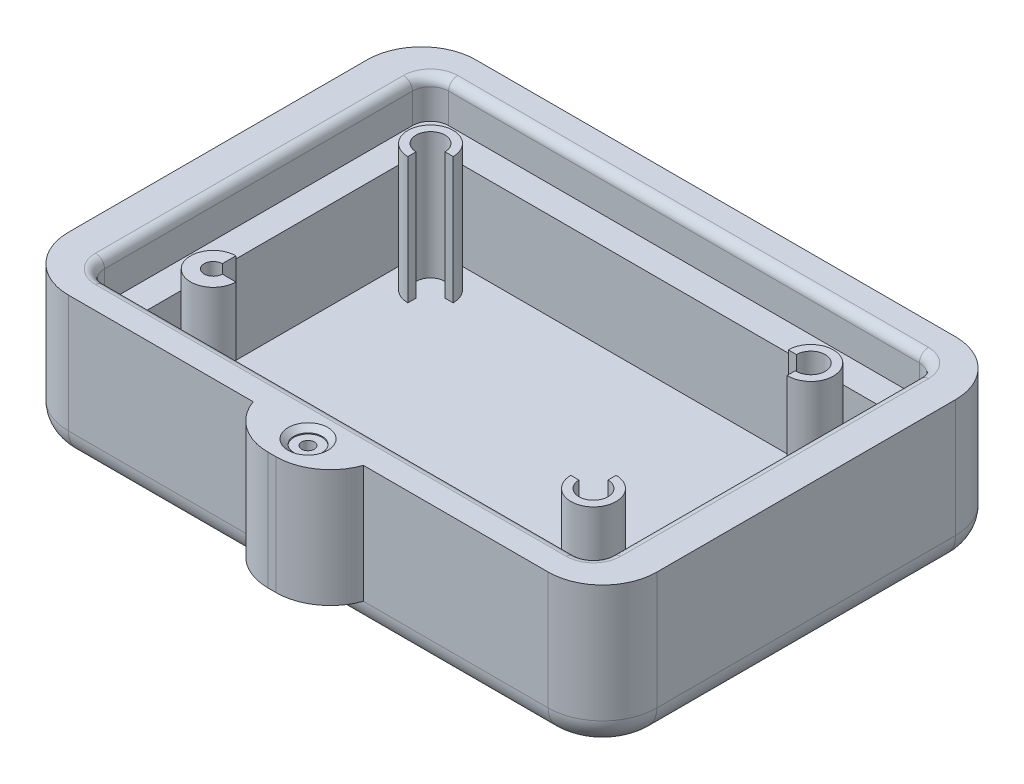
from build123d import *

# Parameters (mm, degrees)
SKETCH1_W               = 82.55
SKETCH1_H               = 57.15
BOSS_EXTRUDE1_DEPTH     = 20.32
FILLET2_R               = 7.62
FILLET3_R               = 3.81
SKETCH2_W               = 63.5
SKETCH2_H               = 40.64
CUT_EXTRUDE1_DEPTH      = 17.78
SKETCH9_W               = 15.46152766
SKETCH9_H               = 16.51
BOSS_EXTRUDE5_DEPTH     = 5.08
FILLET10_R              = 7.62
SKETCH7_W               = 71.12
SKETCH7_H               = 48.26
CUT_EXTRUDE4_DEPTH      = 5.461
FILLET12_R              = 2.54
FILLET13_R              = 1.27
SKETCH5_R               = 3.175
BOSS_EXTRUDE6_DEPTH     = 17.78
SKETCH11_R              = 1.27
SKETCH11_R_2            = 2.032
CUT_EXTRUDE5_DEPTH      = 17.78
CUT_EXTRUDE_THIN1_DEPTH = 102.964471319


with BuildPart() as part:
    # Sketch1 → Boss-Extrude1 (new body)
    with BuildSketch(Plane(origin=(0, 0, 0), x_dir=(1, 0, 0), z_dir=(0, 1, 0))):
        with Locations((41.275, 28.575)):
            Rectangle(SKETCH1_W, SKETCH1_H)
    extrude(amount=BOSS_EXTRUDE1_DEPTH)

    # Fillet2
    fillet2_edges = [part.edges().sort_by_distance(p)[0] for p in [
        (0, 10.16, -57.15),
        (82.55, 10.16, -57.15),
        (82.55, 10.16, 0),
        (0, 10.16, 0),
    ]]
    fillet(fillet2_edges, radius=FILLET2_R)

    # Fillet3
    fillet3_edges = [part.edges().sort_by_distance(p)[0] for p in [
        (41.275, 0, -57.15),
        (0, 0, -28.575),
        (82.55, 0, -28.575),
        (41.275, 0, 0),
        (2.231846327, 0, -54.918153673),
        (2.231846327, 0, -2.231846327),
        (80.318153673, 0, -2.231846327),
        (80.318153673, 0, -54.918153673),
    ]]
    fillet(fillet3_edges, radius=FILLET3_R)

    # Sketch2 → Cut-Extrude1 (cut)
    with BuildSketch(Plane(origin=(0, 20.32, 0), x_dir=(1, 0, 0), z_dir=(0, 1, 0))):
        with Locations((41.275, 28.575)):
            Rectangle(SKETCH2_W, SKETCH2_H)
    extrude(amount=-CUT_EXTRUDE1_DEPTH, mode=Mode.SUBTRACT)

    # Sketch9 → Boss-Extrude5 (add)
    with BuildSketch(Plane.XY):
        with Locations((41.275, 12.065)):
            Rectangle(SKETCH9_W, SKETCH9_H)
    extrude(amount=BOSS_EXTRUDE5_DEPTH)

    # Fillet10
    # the kernel refuses this fillet: 7.62 mm, written as the material it takes off along each edge
    with BuildSketch(Plane(origin=(49.00576383, -14.150512242, 5.08), x_dir=(-1, 0, 0), z_dir=(0, 1, 0))) as fillet10_piece_1:
        with BuildLine():
            CenterArc((7.184204897, -7.62), FILLET10_R, 90, 70.528779366)
            Line((0, -5.08), (-0.143684098, -5.0292))
            ThreePointArc((-0.143684098, -5.0292), (-0.1524, -2.54), (-0.1524, 0))
            Line((-0.1524, 0), (0, 0.1524))
            Line((0, 0.1524), (7.184204897, 0.1524))
            Line((7.184204897, 0.1524), (7.184204897, 0))
        make_face()
    extrude(amount=52.431024484, mode=Mode.SUBTRACT)
    with BuildSketch(Plane(origin=(33.54423617, 38.280512242, 5.08), x_dir=(0, 0, -1), z_dir=(0, -1, 0))) as fillet10_piece_2:
        with BuildLine():
            CenterArc((7.62, 7.184204897), FILLET10_R, 180, 70.528779366)
            Line((0, 7.184204897), (-0.1524, 7.184204897))
            Line((-0.1524, 7.184204897), (-0.1524, 0))
            Line((-0.1524, 0), (0, -0.1524))
            ThreePointArc((0, -0.1524), (2.54, -0.1524), (5.0292, -0.143684098))
            Line((5.0292, -0.143684098), (5.08, 0))
        make_face()
    extrude(amount=52.431024484, mode=Mode.SUBTRACT)

    # Sketch7 → Cut-Extrude4 (cut)
    with BuildSketch(Plane(origin=(0, 20.32, 0), x_dir=(1, 0, 0), z_dir=(0, 1, 0))):
        with Locations((41.275, 28.575)):
            Rectangle(SKETCH7_W, SKETCH7_H)
    extrude(amount=-CUT_EXTRUDE4_DEPTH, mode=Mode.SUBTRACT)

    # Fillet12
    fillet12_edges = [part.edges().sort_by_distance(p)[0] for p in [
        (5.715, 17.5895, -52.705),
        (76.835, 17.5895, -52.705),
        (76.835, 17.5895, -4.445),
        (5.715, 17.5895, -4.445),
    ]]
    fillet(fillet12_edges, radius=FILLET12_R)

    # Fillet13
    fillet13_edges = [part.edges().sort_by_distance(p)[0] for p in [
        (41.275, 20.32, -52.705),
        (76.835, 20.32, -28.575),
        (41.275, 20.32, -4.445),
        (5.715, 20.32, -28.575),
        (76.091051224, 20.32, -51.961051224),
        (76.091051224, 20.32, -5.188948776),
        (6.458948776, 20.32, -51.961051224),
        (6.458948776, 20.32, -5.188948776),
    ]]
    fillet(fillet13_edges, radius=FILLET13_R)

    # Sketch5 → Boss-Extrude6 (add)
    with BuildSketch(Plane(origin=(0, 2.54, 0), x_dir=(1, 0, 0), z_dir=(0, 1, 0))):
        with Locations(Location((14.605, 43.815, 0), (0, 0, 90))):
            Circle(SKETCH5_R)
        with Locations(Location((14.605, 13.335, 0), (0, 0, 90))):
            Circle(SKETCH5_R)
        with Locations(Location((67.945, 43.815, 0), (0, 0, 90))):
            Circle(SKETCH5_R)
        with Locations(Location((67.945, 13.335, 0), (0, 0, 90))):
            Circle(SKETCH5_R)
    extrude(amount=BOSS_EXTRUDE6_DEPTH)

    # Sketch11 → Cut-Extrude5 (cut)
    with BuildSketch(Plane(origin=(0, 20.32, 0), x_dir=(1, 0, 0), z_dir=(0, 1, 0))):
        with Locations(Location((14.605, 13.335, 0), (0, 0, 270))):
            Circle(SKETCH11_R)
        with Locations(Location((14.605, 43.815, 0), (0, 0, 270))):
            Circle(SKETCH11_R_2)
        with Locations(Location((67.945, 13.335, 0), (0, 0, 270))):
            Circle(SKETCH11_R_2)
        with Locations(Location((67.945, 43.815, 0), (0, 0, 270))):
            Circle(SKETCH11_R_2)
    extrude(amount=-CUT_EXTRUDE5_DEPTH, mode=Mode.SUBTRACT)

    # Sketch17 → Cut-Extrude-Thin1 (cut, through all)
    with BuildSketch(Plane(origin=(0, 2.54, 0), x_dir=(1, 0, 0), z_dir=(0, 1, 0))):
        with BuildLine():
            ThreePointArc((67.801605081, 40.643239779), (65.547471879, 41.576932323), (64.613779335, 43.831065525))
            Line((64.613779335, 43.831065525), (67.153779335, 43.831065525))
            ThreePointArc((67.153779335, 43.831065525), (67.343523103, 43.372983547), (67.801605081, 43.183239779))
            Line((67.801605081, 43.183239779), (67.801605081, 40.643239779))
        make_face()
        with BuildLine():
            ThreePointArc((64.77, 13.335), (65.69993597, 15.58006403), (67.945, 16.51))
            Line((67.945, 16.51), (67.945, 13.97))
            ThreePointArc((67.945, 13.97), (67.495987194, 13.784012806), (67.31, 13.335))
            Line((67.31, 13.335), (64.77, 13.335))
        make_face()
        with BuildLine():
            ThreePointArc((17.78, 43.815), (16.85006403, 41.56993597), (14.605, 40.64))
            Line((14.605, 40.64), (14.605, 43.18))
            ThreePointArc((14.605, 43.18), (15.054012806, 43.365987194), (15.24, 43.815))
            Line((15.24, 43.815), (17.78, 43.815))
        make_face()
        with BuildLine():
            ThreePointArc((14.605, 16.51), (16.85006403, 15.58006403), (17.78, 13.335))
            Line((17.78, 13.335), (15.24, 13.335))
            ThreePointArc((15.24, 13.335), (15.054012806, 13.784012806), (14.605, 13.97))
            Line((14.605, 13.97), (14.605, 16.51))
        make_face()
    extrude(amount=CUT_EXTRUDE_THIN1_DEPTH, mode=Mode.SUBTRACT)

    # Sketch19 → CBORE for #0 Binding Head Machine Screw1 (revolve, cut)
    with BuildSketch(Plane(origin=(41.911122971, 20.32, 0.674781491), x_dir=(0, 0, 1), z_dir=(1, 0, 0))):
        Polygon((0, 0), (0, 20.32), (0.889, 20.32), (0.889, 0.8128), (1.98501, 0.8128), (1.98501, 0.668166645), (2.7813, 0), align=None)
    revolve(axis=Axis((41.911122971, 26.67, 0.674781491), (0, -1, 0)), mode=Mode.SUBTRACT)


solid = part.part
